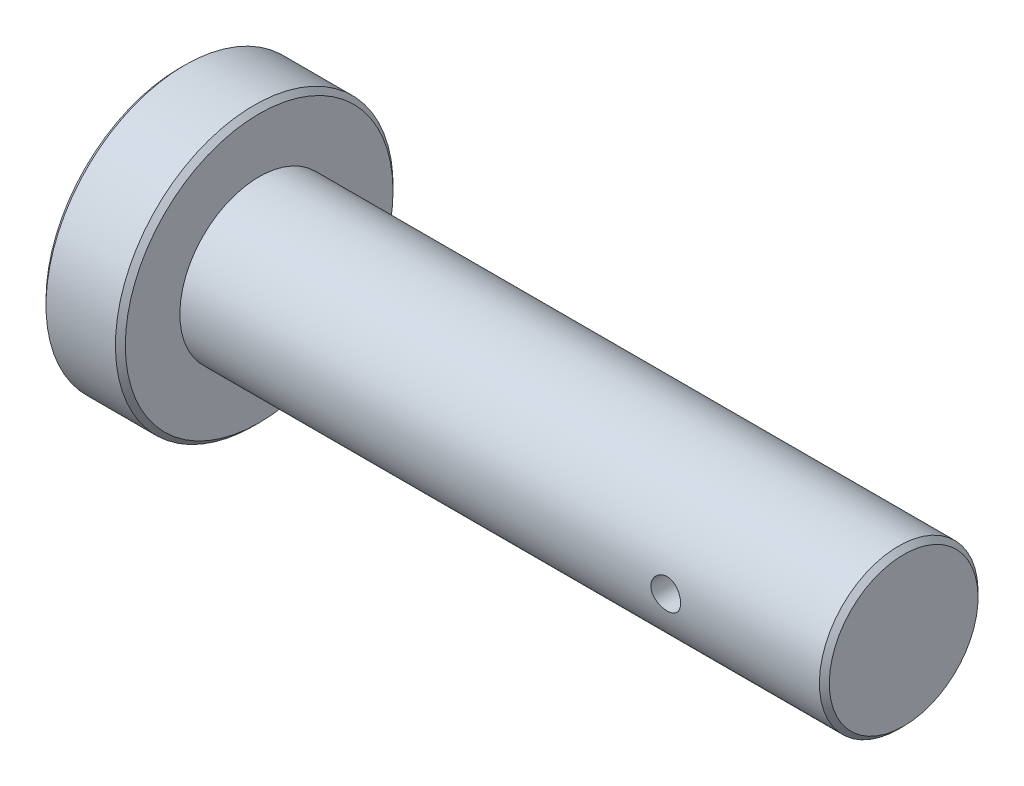
from build123d import *

# Parameters (mm, degrees)
SKETCH3_R          = 1.5
CUT_EXTRUDE1_DEPTH = 20
CHAMFER1_SIZE      = 0.5
SCALE1_SCALE       = 0.7
SCALE2_SCALE       = 0.5
SCALE3_SCALE       = 1.25


with BuildPart() as part:
    # Sketch2 → Revolve1 (revolve)
    with BuildSketch(Plane.XY):
        Polygon((0, 0), (0, 14), (8, 14), (8, 8), (73, 8), (73, 0), align=None)
    revolve(axis=Axis((0, 0, 0), (1, 0, 0)))

    # Sketch3 → Cut-Extrude1 (cut, symmetric)
    with BuildSketch(Plane.XY):
        with Locations((57, 0)):
            Circle(SKETCH3_R)
    extrude(amount=CUT_EXTRUDE1_DEPTH, both=True, mode=Mode.SUBTRACT)

    # Chamfer1
    chamfer1_edges = [part.edges().sort_by_distance(p)[0] for p in [
        (73, -8, 0),
        (8, -14, 0),
        (0, -14, 0),
    ]]
    chamfer(chamfer1_edges, length=CHAMFER1_SIZE)


with BuildPart() as part_1:
    # Scale1: scaled about (30.358985166, 5.12e-07, 0)
    add(part.part.scale(SCALE1_SCALE).moved(Location((9.10769555, 1.54e-07, 0))))


with BuildPart() as part_2:
    # Scale2: scaled about (30.358985166, 5.12e-07, 0)
    add(part_1.part.scale(SCALE2_SCALE).moved(Location((15.179492583, 2.56e-07, 0))))


with BuildPart() as part_3:
    # Scale3: scaled about (30.358985166, 5.12e-07, 0)
    add(part_2.part.scale(SCALE3_SCALE).moved(Location((-7.589746292, -1.28e-07, 0))))


solid = part_3.part
